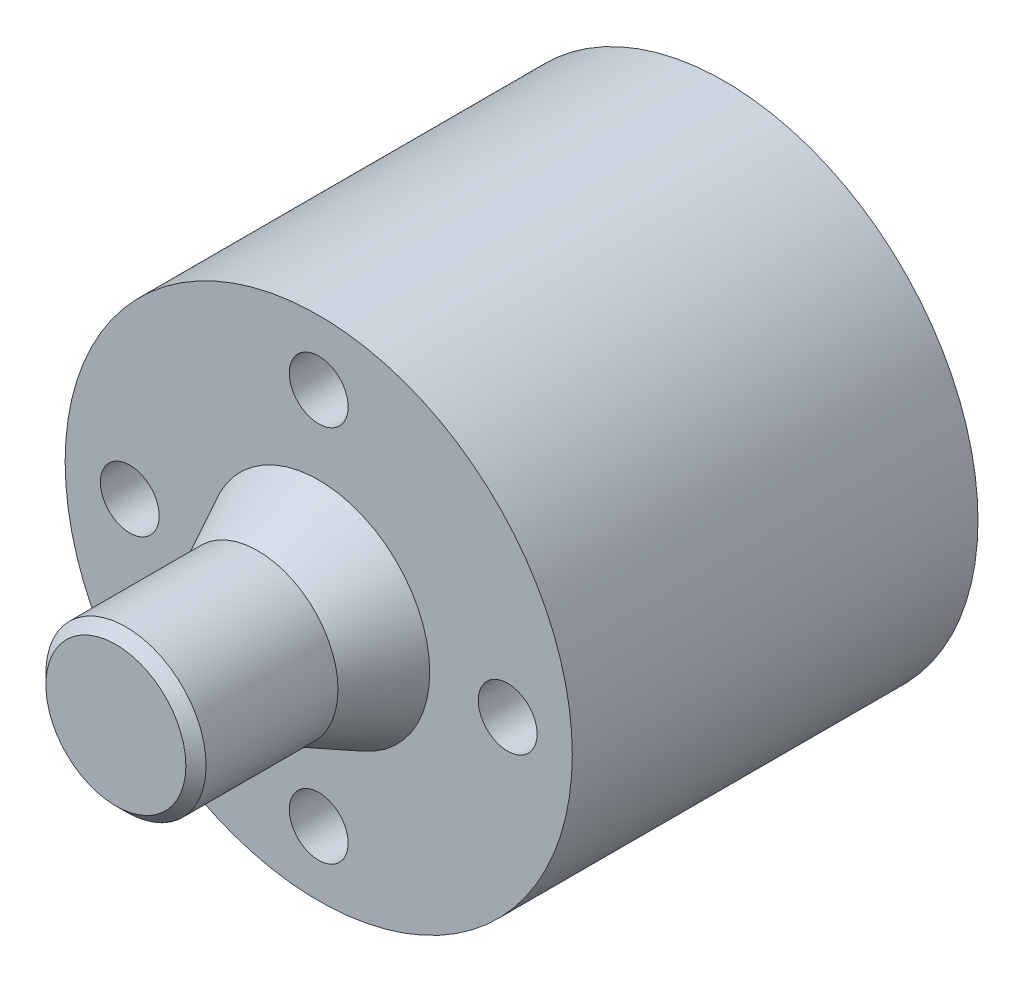
from build123d import *

# Parameters (mm, degrees)
SKETCH1_R           = 12.5
BOSS_EXTRUDE1_DEPTH = 7.5
CUT_EXTRUDE1_REACH  = 25.184
SKETCH8_W           = 12.25
SKETCH8_H           = 12.25
SKETCH11_R          = 1.45
CUT_EXTRUDE4_DEPTH  = 24.184046239
BOSS_EXTRUDE2_START = 5
SKETCH14_R          = 12.5
BOSS_EXTRUDE2_DEPTH = 5
SKETCH15_R          = 3.95
BOSS_EXTRUDE3_DEPTH = 7
CHAMFER1_SIZE       = 0.5
SKETCH18_R          = 1.45
CUT_EXTRUDE6_DEPTH  = 30


with BuildPart() as part:
    # Sketch1 → Boss-Extrude1 (new, symmetric)
    with BuildSketch(Plane.XY):
        Circle(SKETCH1_R)
    extrude(amount=BOSS_EXTRUDE1_DEPTH, both=True)

    # Sketch8 → Cut-Extrude1 (cut, up to next)
    with BuildSketch(Plane.XY.offset(7.5), mode=Mode.PRIVATE) as cut_extrude1_sk1:
        Rectangle(SKETCH8_W, SKETCH8_H)
    cut_extrude1_tool1 = extrude(cut_extrude1_sk1.sketch, amount=-CUT_EXTRUDE1_REACH, mode=Mode.PRIVATE) & part.part
    add(cut_extrude1_tool1.solids().sort_by_distance((0, 0, 7.5))[0], mode=Mode.SUBTRACT)

    # Sketch11 → Cut-Extrude4 (cut, through all)
    with BuildSketch(Plane.XY.offset(7.5)):
        with Locations((9.315, 0)):
            Circle(SKETCH11_R)
        with Locations((0, -9.315)):
            Circle(SKETCH11_R)
        with Locations((-9.315, 0)):
            Circle(SKETCH11_R)
        with Locations((0, 9.315)):
            Circle(SKETCH11_R)
    extrude(amount=-CUT_EXTRUDE4_DEPTH, mode=Mode.SUBTRACT)

    # Sketch14 → Boss-Extrude2 (add)
    with BuildSketch(Plane.XY.offset(7.5).offset(BOSS_EXTRUDE2_START)):
        Circle(SKETCH14_R)
    extrude(amount=-BOSS_EXTRUDE2_DEPTH)

    # Sketch13 → Revolve1 (revolve)
    with BuildSketch(Plane(origin=(0, 0, 0), x_dir=(1, 0, 0), z_dir=(0, 1, 0))):
        Polygon((0, -15.5), (3.95, -15.5), (7.5, -8.506732209), (0, -8.506732209), align=None)
    revolve(axis=Axis((0, 0, 11.965062333), (0, 0, 1)))

    # Sketch15 → Boss-Extrude3 (add)
    with BuildSketch(Plane.XY.offset(15.5)):
        Circle(SKETCH15_R)
    extrude(amount=BOSS_EXTRUDE3_DEPTH)

    # Chamfer1
    chamfer1_edges = [part.edges().sort_by_distance(p)[0] for p in [
        (-3.95, 0, 22.5),
    ]]
    chamfer(chamfer1_edges, length=CHAMFER1_SIZE)

    # Sketch18 → Cut-Extrude6 (cut)
    with BuildSketch(Plane.XY.offset(12.5)):
        with Locations((-9.315, 0)):
            Circle(SKETCH18_R)
        with Locations((0, -9.315)):
            Circle(SKETCH18_R)
        with Locations((9.315, 0)):
            Circle(SKETCH18_R)
        with Locations((0, 9.315)):
            Circle(SKETCH18_R)
    extrude(amount=-CUT_EXTRUDE6_DEPTH, mode=Mode.SUBTRACT)


solid = part.part
